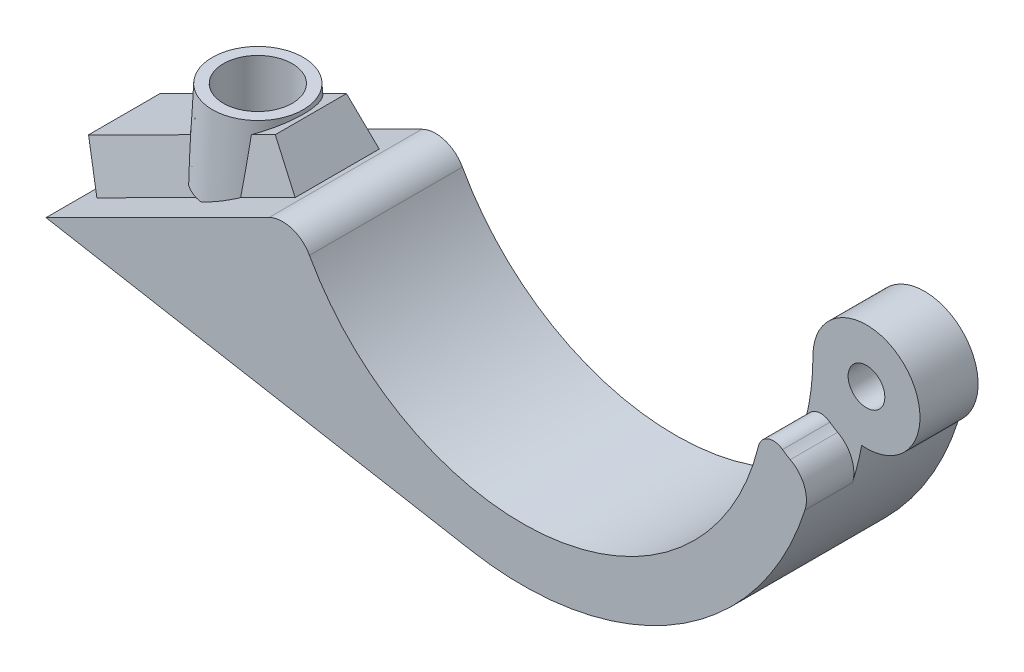
from build123d import *

# Parameters (mm, degrees)
BOSS_EXTRUDE1_DEPTH      = 10
BOSS_EXTRUDE2_DEPTH      = 1.9
BOSS_EXTRUDE2_DEPTH_BACK = 1.9
SKETCH2_R                = 3.5
SKETCH3_R                = 4
CUT_EXTRUDE1_DEPTH       = 39.727380495
SKETCH4_R                = 4
CUT_EXTRUDE2_DEPTH       = 39.727380495
SKETCH5_R                = 1.2
CUT_EXTRUDE3_DEPTH       = 3.8
SKETCH9_W                = 19.801856387
SKETCH9_H                = 10
CUT_EXTRUDE4_DEPTH       = 1
SKETCH12_W               = 14.5
SKETCH12_H               = 5.5
BOSS_EXTRUDE3_DEPTH      = 3
BOSS_EXTRUDE3_TAPER      = 8
SKETCH10_R               = 2.25
CUT_EXTRUDE5_DEPTH       = 37.680126397
FILLET1_R                = 2
FILLET2_R                = 1
CUT_EXTRUDE7_DEPTH       = 7.342905


# Read off the part's stored shape, not the designer's step: Boss-Extrude4
with BuildPart() as part:
    # Sketch1 → Boss-Extrude1 (new body)
    with BuildSketch(Plane.XY):
        with BuildLine():
            Line((-15.093376031, -5), (-32.8, -13.865042807))
            Line((-32.8, -13.865042807), (-3.400702634, -19.099613127))
            ThreePointArc((-3.400702634, -19.099613127), (12.457655656, -14.871678303), (19.4, 0))
            Line((19.4, 0), (15.9, 0))
            ThreePointArc((15.9, 0), (2.532323154, -15.697048749), (-15.093376031, -5))
        make_face()
    extrude(amount=BOSS_EXTRUDE1_DEPTH)

    # Sketch2 → Boss-Extrude2 (add, two sides: drawn at the far end of the back side and taken through both)
    with BuildSketch(Plane.XY.offset(5).offset(-BOSS_EXTRUDE2_DEPTH_BACK)):
        with Locations((19.4, 0)):
            Circle(SKETCH2_R)
    extrude(amount=BOSS_EXTRUDE2_DEPTH + BOSS_EXTRUDE2_DEPTH_BACK)

    # Sketch3 → Cut-Extrude1 (cut, through all)
    with BuildSketch(Plane.XY.offset(6.9)):
        with Locations((19.4, 0)):
            Circle(SKETCH3_R)
    extrude(amount=CUT_EXTRUDE1_DEPTH, mode=Mode.SUBTRACT)

    # Sketch4 → Cut-Extrude2 (cut, through all)
    with BuildSketch(Plane(origin=(0, 0, 3.1), x_dir=(-1, 0, 0), z_dir=(0, 0, -1))):
        with Locations((-19.4, 0)):
            Circle(SKETCH4_R)
    extrude(amount=CUT_EXTRUDE2_DEPTH, mode=Mode.SUBTRACT)

    # Sketch5 → Cut-Extrude3 (cut)
    with BuildSketch(Plane(origin=(0, 0, 3.1), x_dir=(-1, 0, 0), z_dir=(0, 0, -1))):
        with Locations((-19.4, 0)):
            Circle(SKETCH5_R)
    extrude(amount=-CUT_EXTRUDE3_DEPTH, mode=Mode.SUBTRACT)

    # Sketch9 → Cut-Extrude4 (cut)
    with BuildSketch(Plane(origin=(-1.023487263, 2.044265831, 0), x_dir=(0.8941901013439871, 0.4476874609126664, 0), z_dir=(-0.4476874609126664, 0.8941901013439871, 0))):
        with Locations((-25.63571294, -5)):
            Rectangle(SKETCH9_W, SKETCH9_H)
    extrude(amount=-CUT_EXTRUDE4_DEPTH, mode=Mode.SUBTRACT)

    # Sketch12 → Boss-Extrude3 (add)
    with BuildSketch(Plane(origin=(-0.575799802, 1.15007573, 0), x_dir=(0.894190101343987, 0.44768746091266626, 0), z_dir=(-0.4476874609126663, 0.8941901013439871, 0))):
        with Locations((-25.74136864, -5)):
            Rectangle(SKETCH12_W, SKETCH12_H)
    extrude(amount=BOSS_EXTRUDE3_DEPTH, taper=BOSS_EXTRUDE3_TAPER)

    # Boss-Extrude4 outline → Boss-Extrude4 (revolve)
    with BuildSketch(Plane(origin=(-22.3, 0, 5), x_dir=(1, 0, 0), z_dir=(0, 0, 1))):
        Polygon((0, -10), (3.25, -10), (2.968804119, -4.634462949), (0, -4.634462949), align=None)
    revolve(axis=Axis((-22.3, 0, 5), (0, 1, 0)))

    # Sketch10 → Cut-Extrude5 (cut, through all)
    with BuildSketch(Plane(origin=(-1.672257199, 0, 0), x_dir=(1, 0, 0), z_dir=(0, -1, 0))):
        with Locations(Location((-20.627742801, 5, 0), (0, 0, 90))):
            Circle(SKETCH10_R)
    extrude(amount=CUT_EXTRUDE5_DEPTH, mode=Mode.SUBTRACT)

    # Fillet1
    fillet1_edges = [part.edges().sort_by_distance(p)[0] for p in [
        (18.987628866, -3.978686975, 8.45),
        (18.987628866, -3.978686975, 1.55),
        (-14.746830764, -5.944828206, 5),
    ]]
    fillet(fillet1_edges, radius=FILLET1_R)

    # Fillet2
    fillet2_edges = [part.edges().sort_by_distance(p)[0] for p in [
        (15.803350515, -1.750460649, 8.45),
        (15.803350515, -1.750460649, 1.55),
    ]]
    fillet(fillet2_edges, radius=FILLET2_R)

    # Sketch15 → Cut-Extrude7 (cut)
    with BuildSketch(Plane(origin=(0, -20, 0), x_dir=(1, 0, 0), z_dir=(0, 1, 0))):
        Polygon((-19.066838493, -5), (-20.683419246, -2.2), (-23.916580754, -2.2), (-25.533161507, -5), (-23.916580754, -7.8), (-20.683419246, -7.8), align=None)
    extrude(amount=CUT_EXTRUDE7_DEPTH, mode=Mode.SUBTRACT)


solid = part.part
